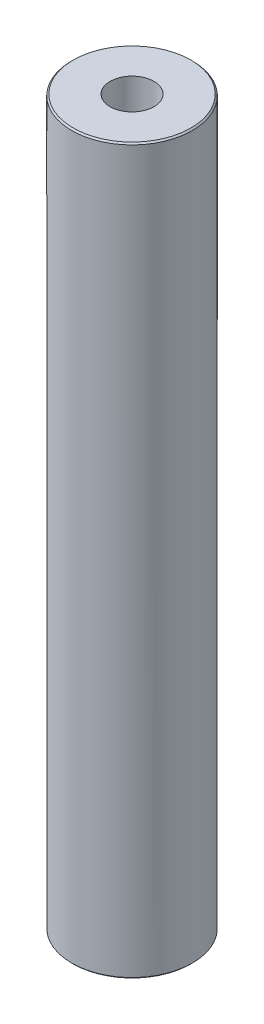
from build123d import *

# Parameters (mm, degrees)
SKETCH1_R           = 50
BOSS_EXTRUDE1_DEPTH = 600
SKETCH2_R           = 18.200282457
CUT_EXTRUDE1_DEPTH  = 605.15229868
CHAMFER1_SIZE       = 1.196075328


with BuildPart() as part:
    # Sketch1 → Boss-Extrude1 (new body)
    with BuildSketch(Plane(origin=(0, 0, 0), x_dir=(1, 0, 0), z_dir=(0, 1, 0))):
        Circle(SKETCH1_R)
    extrude(amount=BOSS_EXTRUDE1_DEPTH)

    # Sketch2 → Cut-Extrude1 (cut, through all)
    with BuildSketch(Plane(origin=(0, 0, 0), x_dir=(1, 0, 0), z_dir=(0, 1, 0))):
        Circle(SKETCH2_R)
    extrude(amount=CUT_EXTRUDE1_DEPTH, mode=Mode.SUBTRACT)

    # Chamfer1
    chamfer1_edges = [part.edges().sort_by_distance(p)[0] for p in [
        (-50, 600, 0),
        (-50, 0, 0),
    ]]
    chamfer(chamfer1_edges, length=CHAMFER1_SIZE)


solid = part.part
